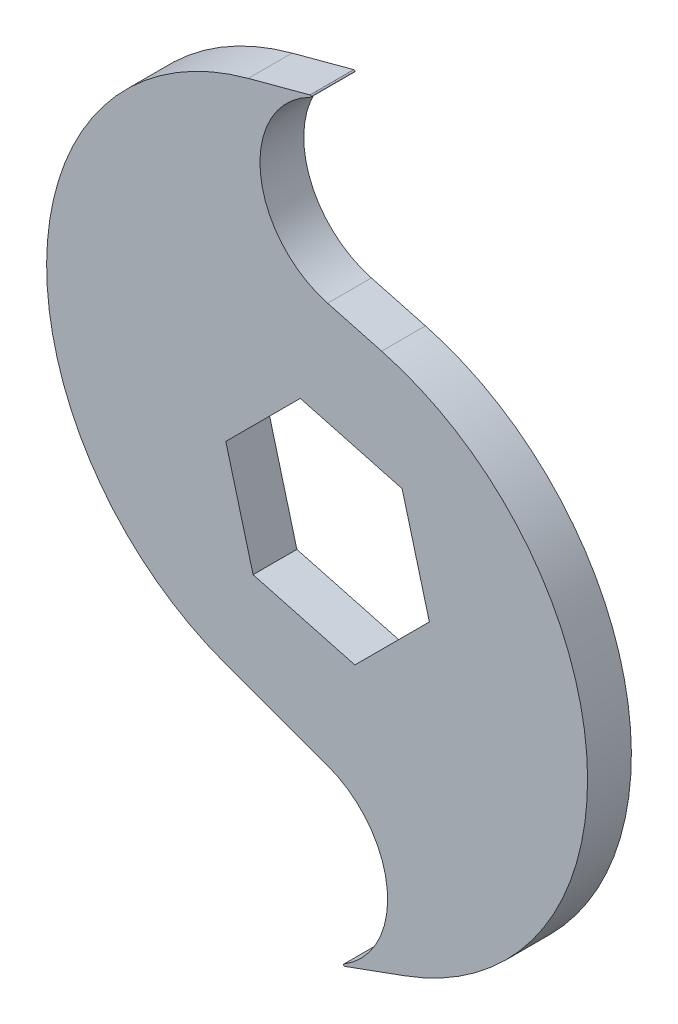
from build123d import *

# Parameters (mm, degrees)
BOSS_EXTRUDE1_DEPTH = 3.048
FILLET1_R           = 0.127


with BuildPart() as part:
    # Sketch1 → Boss-Extrude1 (new, symmetric)
    with BuildSketch(Plane.XY):
        with BuildLine():
            Line((0, 52.07), (-11.040532194, 49.111698314))
            ThreePointArc((-11.040532194, 49.111698314), (-39.066320922, 14.192289272), (-14.190605813, -23.03684931))
            Line((-14.190605813, -23.03684931), (0, -28.201807432))
            ThreePointArc((0, -28.201807432), (8.35634418, -40.135903716), (0, -52.07))
            Line((0, -52.07), (10.740686656, -48.160709762))
            ThreePointArc((10.740686656, -48.160709762), (36.144496882, -10.141220984), (7.52373904, 25.519504212))
            Line((7.52373904, 25.519504212), (0, 27.535484012))
            ThreePointArc((0, 27.535484012), (-9.412998127, 39.802742006), (0, 52.07))
        make_face()
        Polygon((-3.795502832, 14.16500941), (-14.16500941, 3.795502832), (-10.369506578, -10.369506578), (3.795502832, -14.16500941), (14.16500941, -3.795502832), (10.369506578, 10.369506578), align=None, mode=Mode.SUBTRACT)
    extrude(amount=BOSS_EXTRUDE1_DEPTH, both=True)

    # Fillet1
    fillet1_edges = [part.edges().sort_by_distance(p)[0] for p in [
        (0, 52.07, 0),
        (0, -52.07, 0),
    ]]
    fillet(fillet1_edges, radius=FILLET1_R)


solid = part.part
